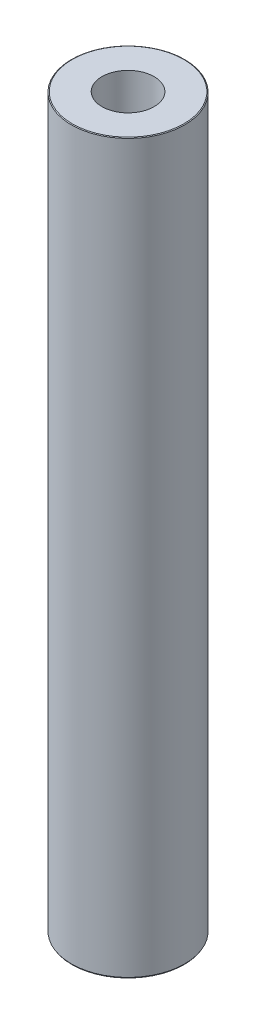
from build123d import *
from OCP.BRepFilletAPI import BRepFilletAPI_MakeChamfer

# Parameters (mm, degrees)
SKETCH1_R           = 27.5
BOSS_EXTRUDE1_DEPTH = 353.360213943
SKETCH2_R           = 12.657704102
CUT_EXTRUDE1_DEPTH  = 356.493939185
CHAMFER1_SIZE       = 0.246221207
CHAMFER1_SIZE2      = 0.42646764


with BuildPart() as part:
    # Sketch1 → Boss-Extrude1 (new body)
    with BuildSketch(Plane(origin=(0, 0, 0), x_dir=(1, 0, 0), z_dir=(0, 1, 0))):
        Circle(SKETCH1_R)
    extrude(amount=BOSS_EXTRUDE1_DEPTH)

    # Sketch2 → Cut-Extrude1 (cut, through all)
    with BuildSketch(Plane(origin=(0, 0, 0), x_dir=(1, 0, 0), z_dir=(0, 1, 0))):
        Circle(SKETCH2_R)
    extrude(amount=CUT_EXTRUDE1_DEPTH, mode=Mode.SUBTRACT)

    # Chamfer1: one chamfer whose edges measure the first distance from different faces: ONE call of the kernel's chamfer builder (chamfer() names one face for all edges)
    chamfer1_edges_1 = [part.edges().sort_by_distance(p)[0] for p in [
        (-27.5, 353.360213943, 0),
    ]]
    chamfer1_side_1 = [part.faces().sort_by_distance(p)[0] for p in [
        (-27.5, 176.680106971, 0),
    ]]
    chamfer1_edges_2 = [part.edges().sort_by_distance(p)[0] for p in [
        (-27.5, 0, 0),
    ]]
    chamfer1_side_2 = [part.faces().sort_by_distance(p)[0] for p in [
        (-26.722182541, 0, 0),
    ]]
    chamfer1 = BRepFilletAPI_MakeChamfer(part.part.solid().wrapped)
    for e in chamfer1_edges_1:
        chamfer1.Add(CHAMFER1_SIZE, CHAMFER1_SIZE2, e.wrapped, chamfer1_side_1[0].wrapped)  # the first distance lies on this face
    for e in chamfer1_edges_2:
        chamfer1.Add(CHAMFER1_SIZE, CHAMFER1_SIZE2, e.wrapped, chamfer1_side_2[0].wrapped)  # the first distance lies on this face
    add(Compound.cast(chamfer1.Shape()), mode=Mode.REPLACE)


solid = part.part
